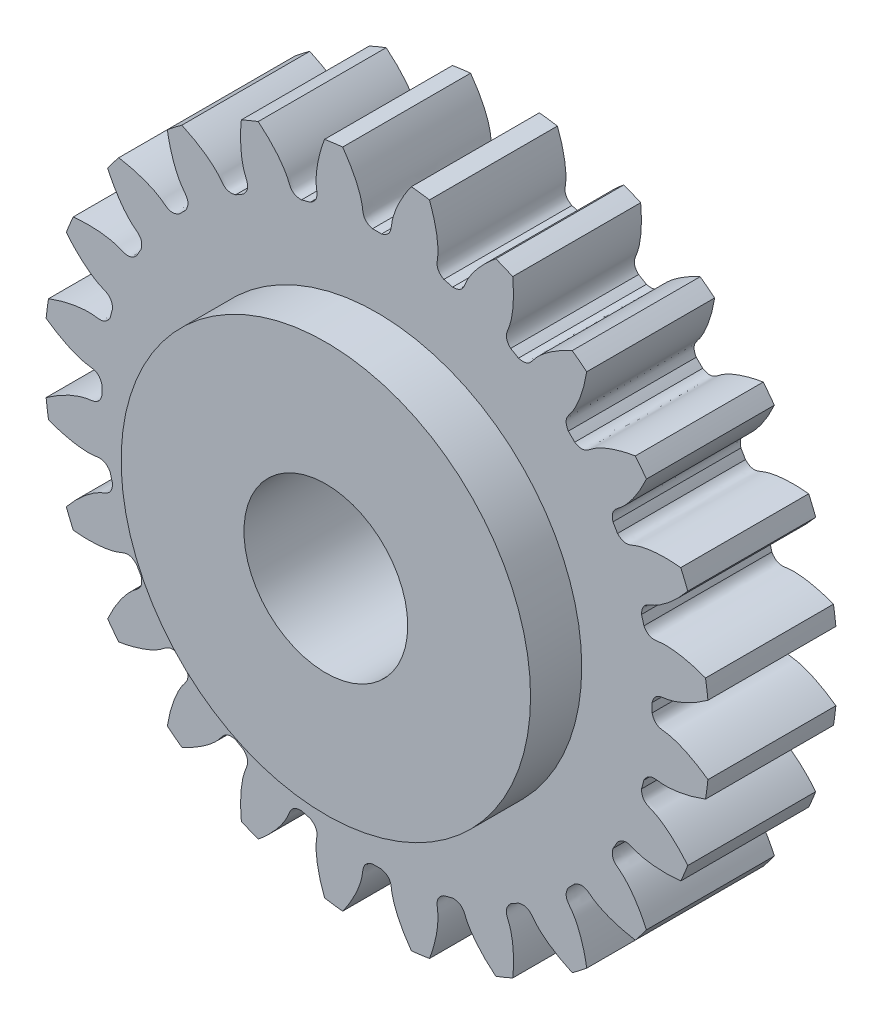
from build123d import *

# Parameters (mm, degrees)
SKETCH_1_R               = 6.5
EXTRUDE_1_DEPTH          = 2.5
CUT_EXTRUDE_1_DEPTH      = 10.526279442
PATTERN_CIRCULAR_1_COUNT = 24
SKETCH_5_R               = 4
EXTRUDE_2_DEPTH          = 1
SKETCH_4_R               = 1.6
CUT_EXTRUDE_2_DEPTH      = 5


with BuildPart() as part:
    # 草图1 → 凸台-拉伸1 (new body)
    with BuildSketch(Plane.XY):
        Circle(SKETCH_1_R)
    extrude(amount=EXTRUDE_1_DEPTH)

    # 草图2 → 切除-拉伸1 (cut, through all)
    with BuildSketch(Plane.XY):
        with BuildLine():
            ThreePointArc((0.088415956, 5.374272753), (0, 5.375), (-0.088415956, 5.374272753))
            add(Edge.make_bspline(
                [(-0.088415956, 5.374272753), (-0.283956108, 5.428430036), (-0.269523883, 5.557861799), (-0.293138588, 5.686342226), (-0.296517959, 5.702916521), (-0.300724242, 5.721620073), (-0.305840304, 5.742426358), (-0.311952817, 5.765305336), (-0.319146149, 5.790224685), (-0.327504211, 5.817149434), (-0.337109789, 5.846042111), (-0.348044663, 5.876862729), (-0.360389484, 5.909568827), (-0.374223721, 5.944115495), (-0.389625595, 5.980455405), (-0.406672011, 6.018538843), (-0.425438499, 6.058313744), (-0.445999145, 6.099725726), (-0.468426535, 6.142718129), (-0.492791687, 6.187232054), (-0.519163995, 6.233206399), (-0.547611171, 6.280577906), (-0.57819918, 6.329281201), (-0.610992189, 6.379248841), (-0.64605251, 6.430411359), (-0.68344054, 6.482697309), (-0.723214712, 6.53603332), (-0.765431443, 6.590344144), (-0.810145078, 6.645552705), (-0.857407842, 6.701580158), (-0.907269792, 6.758345935), (-0.959778768, 6.81576781), (-1.014980347, 6.873761948), (-1.0729178, 6.932242967), (-1.133632047, 6.991123994), (-1.197161611, 7.05031673), (-1.263542589, 7.109731505), (-1.332808587, 7.169277345), (-1.430211047, 7.249680778), (-1.505961903, 7.308439159), (-1.55780976, 7.347058965)],
                knots=[0, 0, 0, 0, 0.143961355, 0.149818462, 0.156576662, 0.164235955, 0.172796342, 0.182257821, 0.192620395, 0.203884061, 0.216048821, 0.229114674, 0.24308162, 0.25794966, 0.273718793, 0.290389019, 0.307960339, 0.326432751, 0.345806258, 0.366080857, 0.38725655, 0.409333336, 0.432311215, 0.456190188, 0.480970254, 0.506651413, 0.533233666, 0.560717012, 0.589101451, 0.618386984, 0.64857361, 0.679661329, 0.711650141, 0.744540047, 0.778331046, 0.813023138, 0.848616324, 0.885110603, 0.922505975, 1, 1, 1, 1], degree=3))
            ThreePointArc((-1.55780976, 7.347058965), (0, 7.510395907), (1.55780976, 7.347058965))
            add(Edge.make_bspline(
                [(0.088415956, 5.374272753), (0.283956108, 5.428430036), (0.269523883, 5.557861799), (0.293138588, 5.686342226), (0.296517959, 5.702916521), (0.300724242, 5.721620073), (0.305840304, 5.742426358), (0.311952817, 5.765305336), (0.319146149, 5.790224685), (0.327504211, 5.817149434), (0.337109789, 5.846042111), (0.348044663, 5.876862729), (0.360389484, 5.909568827), (0.374223721, 5.944115495), (0.389625595, 5.980455405), (0.406672011, 6.018538843), (0.425438499, 6.058313744), (0.445999145, 6.099725726), (0.468426535, 6.142718129), (0.492791687, 6.187232054), (0.519163995, 6.233206399), (0.547611171, 6.280577906), (0.57819918, 6.329281201), (0.610992189, 6.379248841), (0.64605251, 6.430411359), (0.68344054, 6.482697309), (0.723214712, 6.53603332), (0.765431443, 6.590344144), (0.810145078, 6.645552705), (0.857407842, 6.701580158), (0.907269792, 6.758345935), (0.959778768, 6.81576781), (1.014980347, 6.873761948), (1.0729178, 6.932242967), (1.133632047, 6.991123994), (1.197161611, 7.05031673), (1.263542589, 7.109731505), (1.332808587, 7.169277345), (1.430211047, 7.249680778), (1.505961903, 7.308439159), (1.55780976, 7.347058965)],
                knots=[0, 0, 0, 0, 0.143961355, 0.149818462, 0.156576662, 0.164235955, 0.172796342, 0.182257821, 0.192620395, 0.203884061, 0.216048821, 0.229114674, 0.24308162, 0.25794966, 0.273718793, 0.290389019, 0.307960339, 0.326432751, 0.345806258, 0.366080857, 0.38725655, 0.409333336, 0.432311215, 0.456190188, 0.480970254, 0.506651413, 0.533233666, 0.560717012, 0.589101451, 0.618386984, 0.64857361, 0.679661329, 0.711650141, 0.744540047, 0.778331046, 0.813023138, 0.848616324, 0.885110603, 0.922505975, 1, 1, 1, 1], degree=3))
        make_face()
    cut_extrude_1 = extrude(amount=CUT_EXTRUDE_1_DEPTH, mode=Mode.SUBTRACT)

    # 阵列(圆周)1: 切除-拉伸1 ×24 about axis
    pattern_circular_1_axis = Axis((0, 0, 2.5), (0, 0, -1))
    for i in range(1, PATTERN_CIRCULAR_1_COUNT):
        add(cut_extrude_1.rotate(pattern_circular_1_axis, i * 360 / PATTERN_CIRCULAR_1_COUNT), mode=Mode.SUBTRACT)

    # 草图5 → 凸台-拉伸2 (add)
    with BuildSketch(Plane.XY.offset(2.5)):
        Circle(SKETCH_5_R)
    extrude(amount=EXTRUDE_2_DEPTH)

    # 草图4 → 切除-拉伸2 (cut, symmetric)
    with BuildSketch(Plane.XY.offset(2.5)):
        Circle(SKETCH_4_R)
    extrude(amount=CUT_EXTRUDE_2_DEPTH, both=True, mode=Mode.SUBTRACT)


solid = part.part
